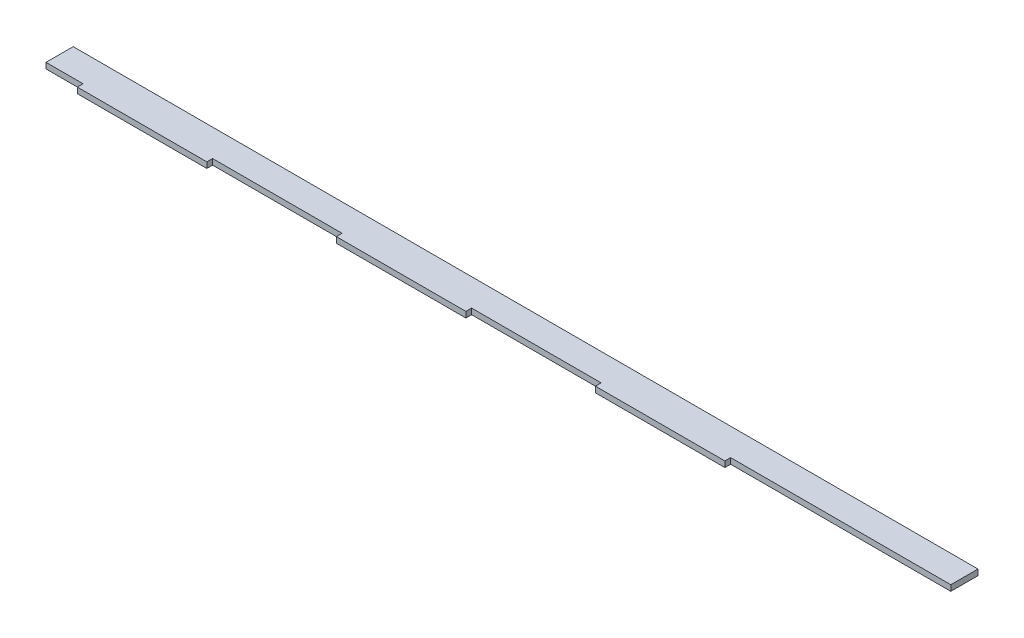
from build123d import *

# Parameters (mm, degrees)
BOSS_EXTRUDE1_DEPTH = 3.175


with BuildPart() as part:
    # Sketch1 → Boss-Extrude1 (new body)
    with BuildSketch(Plane(origin=(0, 0, 0), x_dir=(1, 0, 0), z_dir=(0, 1, 0))):
        Polygon((29.557142857, 15), (29.557142857, 0), (49.985714286, 0), (49.985714286, -3.175), (121.414285714, -3.175), (121.414285714, 0), (192.842857143, 0), (192.842857143, -3.175), (264.271428571, -3.175), (264.271428571, 0), (335.7, 0), (335.7, -3.175), (407.128571429, -3.175), (407.128571429, 0), (528.557142857, 0), (528.557142857, 15), align=None)
    extrude(amount=BOSS_EXTRUDE1_DEPTH)


solid = part.part
